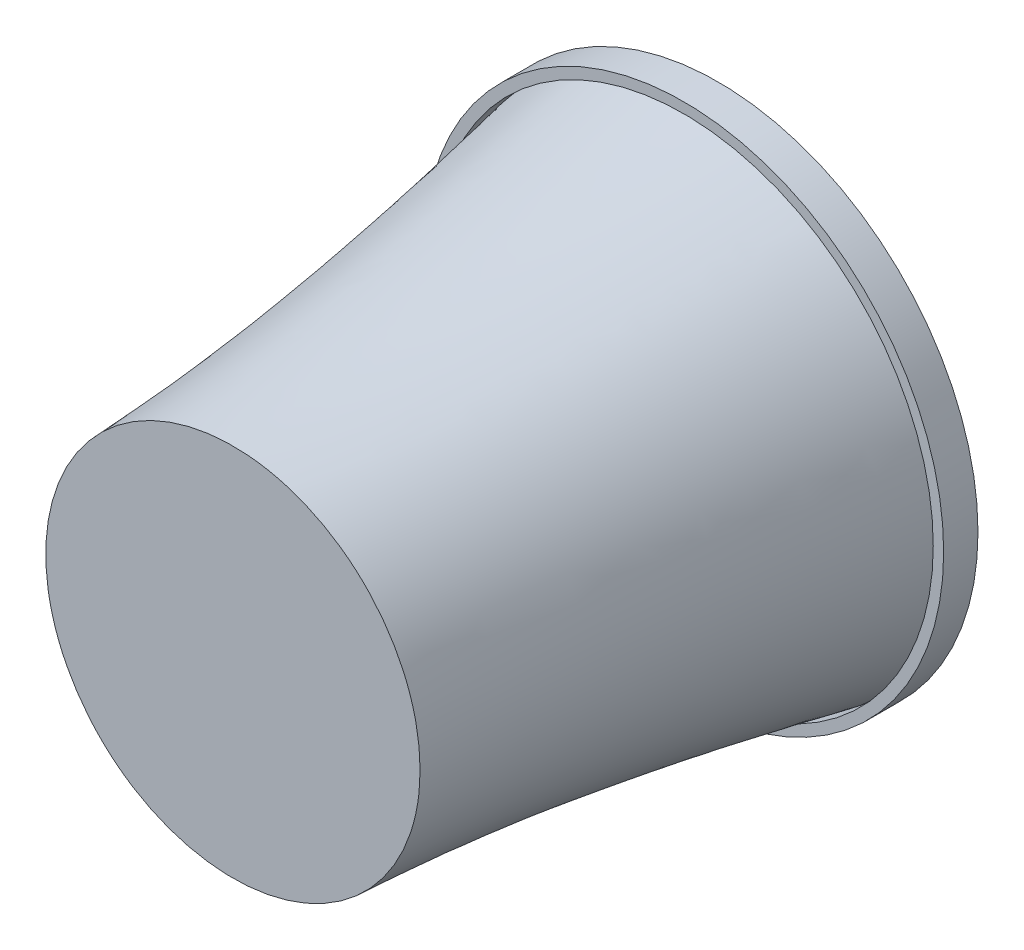
from build123d import *

# Parameters (mm, degrees)
SKETCH1_5_R         = 83.336833521
SKETCH1_5_R_2       = 80
BOSS_EXTRUDE1_DEPTH = 5.5


with BuildPart() as part:
    # Loft1: read off the stored shape, not the designer's step
    # Loft1: loft between two sections, ruled curve by curve
    loft1_from = [
        Edge.make_bspline([(-50.003073395, -33.16161412, 150), (-116.326301635, 66.844532671, 150), (-16.320154844, 133.16776091, 150), (50.003073395, 33.16161412, 150), (116.326301635, -66.844532671, 150), (16.320154844, -133.16776091, 150), (-50.003073395, -33.16161412, 150)], [0, 0, 0, 0, 0.5, 0.5, 0.5, 1, 1, 1, 1], 3, [1, 0.333333333, 0.333333333, 1, 0.333333333, 0.333333333, 1]),
    ]
    loft1_to = [
        Edge.make_bspline([(-79.999605216, 0.251326999, 0), (-79.496951218, 160.250537431, 0), (80.502259214, 159.747883433, 0), (79.999605216, -0.251326999, 0), (79.496951218, -160.250537431, 0), (-80.502259214, -159.747883433, 0), (-79.999605216, 0.251326999, 0)], [0, 0, 0, 0, 0.5, 0.5, 0.5, 1, 1, 1, 1], 3, [1, 0.333333333, 0.333333333, 1, 0.333333333, 0.333333333, 1]),
    ]
    loft1 = Solid(Shell([*[Face.make_surface_from_curves(loft1_from[k], loft1_to[k]) for k in range(1)], Face(Wire(loft1_from)), Face(Wire(loft1_to))]))
    add(loft1)


with BuildPart() as body_2:
    # Sketch1<5> → Boss-Extrude1 (new, symmetric)
    with BuildSketch(Plane.XY):
        Circle(SKETCH1_5_R)
        Circle(SKETCH1_5_R_2, mode=Mode.SUBTRACT)
    extrude(amount=BOSS_EXTRUDE1_DEPTH, both=True)


solid = Compound([part.part, body_2.part])
